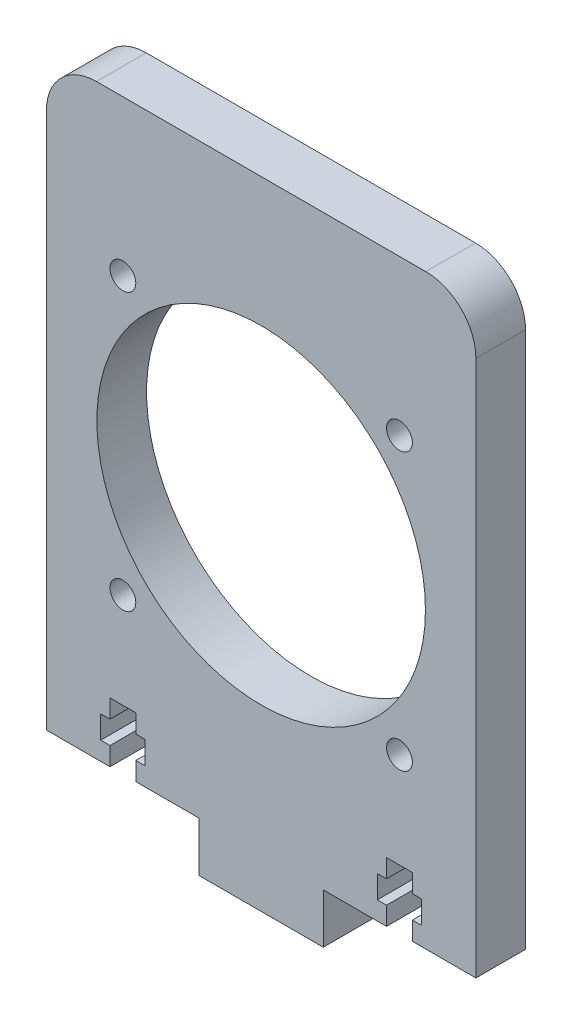
from build123d import *

# Parameters (mm, degrees)
SKETCH1_W           = 109.8
SKETCH1_H           = 150
SKETCH1_R           = 3.3
SKETCH1_R_2         = 42
BOSS_EXTRUDE1_DEPTH = 12.7
CUT_EXTRUDE1_DEPTH  = 94.809914188
BOSS_EXTRUDE2_DEPTH = 12.7
FILLET1_R           = 12.8


with BuildPart() as part:
    # Sketch1 → Boss-Extrude1 (new body)
    with BuildSketch(Plane.XY):
        Rectangle(SKETCH1_W, SKETCH1_H)
        with Locations((-35.355339059, -35.355339059)):
            Circle(SKETCH1_R, mode=Mode.SUBTRACT)
        with Locations((35.355339059, -35.355339059)):
            Circle(SKETCH1_R, mode=Mode.SUBTRACT)
        with Locations((-35.355339059, 35.355339059)):
            Circle(SKETCH1_R, mode=Mode.SUBTRACT)
        Circle(SKETCH1_R_2, mode=Mode.SUBTRACT)
        with Locations((35.355339059, 35.355339059)):
            Circle(SKETCH1_R, mode=Mode.SUBTRACT)
    extrude(amount=BOSS_EXTRUDE1_DEPTH)

    # Sketch2 → Cut-Extrude1 (cut, through all)
    with BuildSketch(Plane(origin=(0, 0, 0), x_dir=(-1, 0, 0), z_dir=(0, 0, -1))):
        Polygon((32.05, -70.3), (32.05, -75), (38.65, -75), (38.65, -70.3), (41.014, -70.3), (41.014, -64.46), (38.65, -64.46), (38.65, -59.76), (32.05, -59.76), (32.05, -64.46), (29.686, -64.46), (29.686, -70.3), align=None)
        Polygon((-38.65, -75), (-32.05, -75), (-32.05, -70.3), (-29.686, -70.3), (-29.686, -64.46), (-32.05, -64.46), (-32.05, -59.76), (-38.65, -59.76), (-38.65, -64.46), (-41.014, -64.46), (-41.014, -70.3), (-38.65, -70.3), align=None)
    extrude(amount=-CUT_EXTRUDE1_DEPTH, mode=Mode.SUBTRACT)

    # Sketch4 → Boss-Extrude2 (add)
    with BuildSketch(Plane.XZ.offset(75)):
        Polygon((0, 0), (15.875, 0), (15.875, 12.7), (-15.875, 12.7), (-15.875, 0), align=None)
    extrude(amount=BOSS_EXTRUDE2_DEPTH)

    # Fillet1
    fillet1_edges = [part.edges().sort_by_distance(p)[0] for p in [
        (-54.9, 75, 6.35),
        (54.9, 75, 6.35),
    ]]
    fillet(fillet1_edges, radius=FILLET1_R)


solid = part.part
